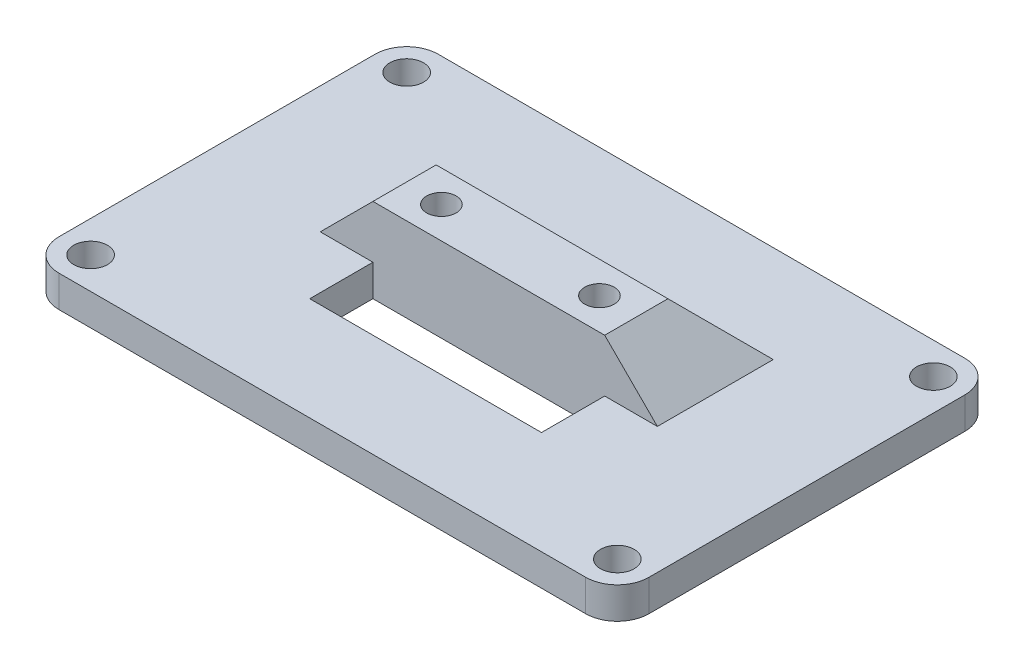
from build123d import *

# Parameters (mm, degrees)
SKETCH_1_W          = 56
SKETCH_1_H          = 36
SKETCH_1_R          = 1.6
EXTRUDE_1_DEPTH     = 3
FILLET_1_R          = 3
SKETCH_2_W          = 22
SKETCH_2_H          = 6
SKETCH_2_R          = 1.4
EXTRUDE_2_DEPTH     = 5
SKETCH_3_W          = 22
SKETCH_3_H          = 6
CUT_EXTRUDE_1_DEPTH = 34.660065359
CHAMFER_1_SIZE      = 5


with BuildPart() as part:
    # ｽｹｯﾁ1 → ﾎﾞｽ - 押し出し1 (new body)
    with BuildSketch(Plane(origin=(0, 0, 0), x_dir=(1, 0, 0), z_dir=(0, 1, 0))):
        Rectangle(SKETCH_1_W, SKETCH_1_H)
        with Locations(Location((-25, 15, 0), (0, 0, 270))):
            Circle(SKETCH_1_R, mode=Mode.SUBTRACT)
        with Locations(Location((25, 15, 0), (0, 0, 270))):
            Circle(SKETCH_1_R, mode=Mode.SUBTRACT)
        with Locations(Location((25, -15, 0), (0, 0, 270))):
            Circle(SKETCH_1_R, mode=Mode.SUBTRACT)
        with Locations(Location((-25, -15, 0), (0, 0, 270))):
            Circle(SKETCH_1_R, mode=Mode.SUBTRACT)
    extrude(amount=EXTRUDE_1_DEPTH)

    # ﾌｨﾚｯﾄ1
    fillet_1_edges = [part.edges().sort_by_distance(p)[0] for p in [
        (28, 1.5, 18),
        (-28, 1.5, 18),
        (-28, 1.5, -18),
        (28, 1.5, -18),
    ]]
    fillet(fillet_1_edges, radius=FILLET_1_R)

    # ｽｹｯﾁ2 → ﾎﾞｽ - 押し出し2 (add)
    with BuildSketch(Plane(origin=(0, 3, 0), x_dir=(1, 0, 0), z_dir=(0, 1, 0))):
        with Locations((0, 0.8)):
            Rectangle(SKETCH_2_W, SKETCH_2_H)
        with Locations(Location((-7.5, 0.8, 0), (0, 0, 270))):
            Circle(SKETCH_2_R, mode=Mode.SUBTRACT)
        with Locations(Location((7.5, 0.8, 0), (0, 0, 270))):
            Circle(SKETCH_2_R, mode=Mode.SUBTRACT)
    extrude(amount=EXTRUDE_2_DEPTH)

    # ｽｹｯﾁ3 → ｶｯﾄ - 押し出し1 (cut, through all)
    with BuildSketch(Plane(origin=(0, 3, 0), x_dir=(1, 0, 0), z_dir=(0, 1, 0))):
        with Locations((0, -5.2)):
            Rectangle(SKETCH_3_W, SKETCH_3_H)
    extrude(amount=-CUT_EXTRUDE_1_DEPTH, mode=Mode.SUBTRACT)

    # 面取り1
    chamfer_1_edges = [part.edges().sort_by_distance(p)[0] for p in [
        (-11, 3, -0.8),
        (11, 3, -0.8),
        (0, 3, -3.8),
    ]]
    chamfer(chamfer_1_edges, length=CHAMFER_1_SIZE - 0.0001)  # a hair under: the kernel refuses the full size


solid = part.part
